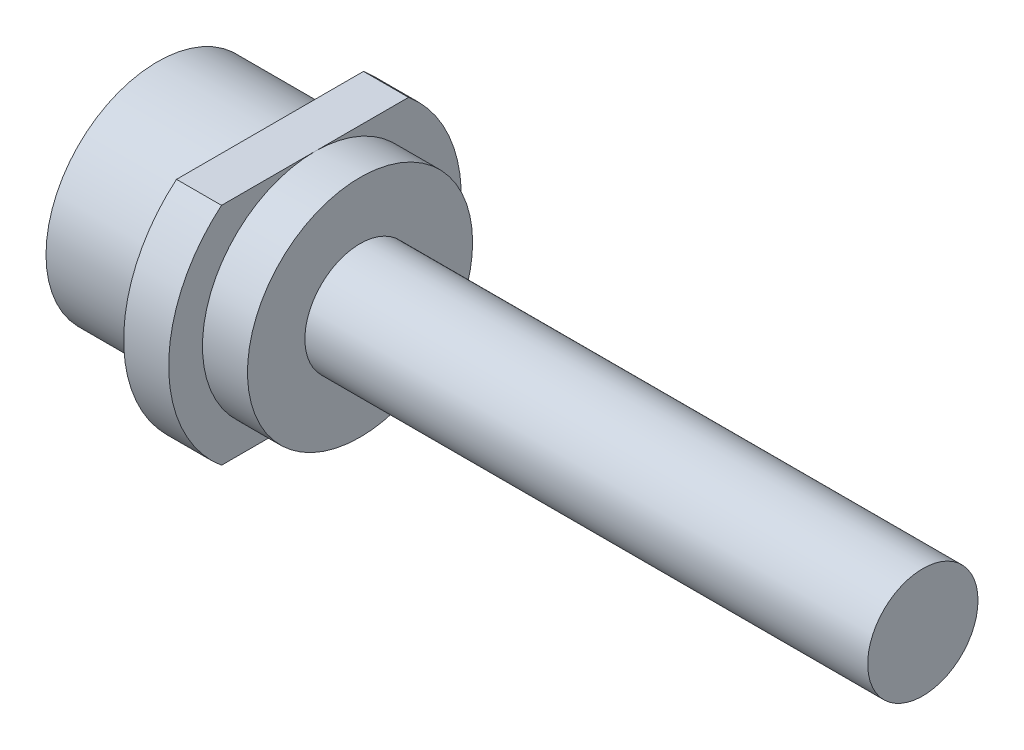
from build123d import *

# Parameters (mm, degrees)
EXTRUDE_1_DEPTH = 2
SKETCH_3_R      = 5
EXTRUDE_2_DEPTH = 2
SKETCH_4_R      = 2.45
EXTRUDE_3_DEPTH = 25
SKETCH_5_R      = 4.95
EXTRUDE_4_DEPTH = 5


with BuildPart() as part:
    # 草图2 → 凸台-拉伸1 (new body)
    with BuildSketch(Plane(origin=(0, 0, 0), x_dir=(0, 0, -1), z_dir=(1, 0, 0))):
        with BuildLine():
            Line((4.153311931, 5), (-4.153311931, 5))
            ThreePointArc((-4.153311931, 5), (-6.5, 0), (-4.153311931, -5))
            Line((-4.153311931, -5), (4.153311931, -5))
            ThreePointArc((4.153311931, -5), (6.5, 0), (4.153311931, 5))
        make_face()
    extrude(amount=EXTRUDE_1_DEPTH)

    # 草图3 → 凸台-拉伸2 (add)
    with BuildSketch(Plane(origin=(2, 0, 0), x_dir=(0, 0, -1), z_dir=(1, 0, 0))):
        Circle(SKETCH_3_R)
    extrude(amount=EXTRUDE_2_DEPTH)

    # 草图4 → 凸台-拉伸3 (add)
    with BuildSketch(Plane(origin=(4, 0, 0), x_dir=(0, 0, -1), z_dir=(1, 0, 0))):
        Circle(SKETCH_4_R)
    extrude(amount=EXTRUDE_3_DEPTH)

    # 草图5 → 凸台-拉伸4 (add)
    with BuildSketch(Plane.ZY):
        Circle(SKETCH_5_R)
    extrude(amount=EXTRUDE_4_DEPTH)


solid = part.part
